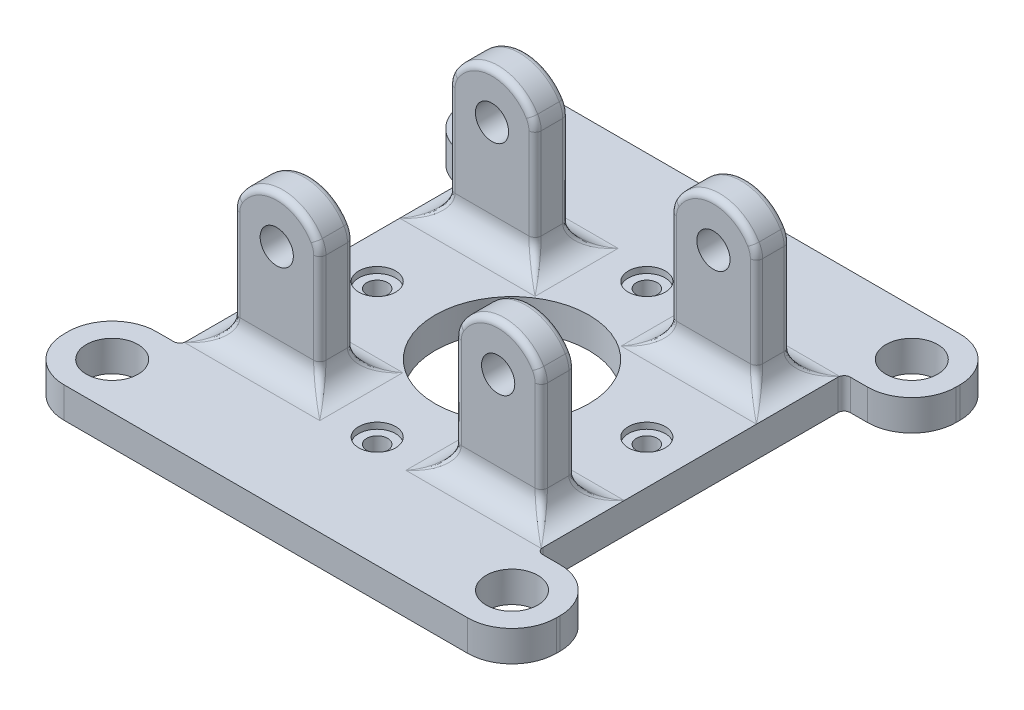
from build123d import *

# Parameters (mm, degrees)
SKETCH1_W                                        = 80
SKETCH1_H                                        = 80
SKETCH1_R                                        = 12.5
BOSS_EXTRUDE1_BASE_DEPTH                         = 5
SKETCH2_W                                        = 14
SKETCH2_H                                        = 5.5
BOSS_EXTRUDE2_FLAPS_DEPTH                        = 25
CUT_EXTRUDE1_SB_HOLE_AND_FLAP_GEO_REACH          = 80.295
SKETCH3_R                                        = 2.7
F_8_0MM_DOWEL_HOLE1_D                            = 8.4
CBORE_FOR_M3_HEX_HEAD_MACHINE_SCREW1_D           = 3.4
CBORE_FOR_M3_HEX_HEAD_MACHINE_SCREW1_CBORE_D     = 6
CBORE_FOR_M3_HEX_HEAD_MACHINE_SCREW1_CBORE_DEPTH = 1
CUT_EXTRUDE4_REACH                               = 63.646
SKETCH16_W                                       = 22
SKETCH16_H                                       = 50
FILLET1_R                                        = 4
FILLET2_R                                        = 1
FILLET3_R                                        = 7.2


with BuildPart() as part:
    # Sketch1 → Boss-Extrude1 - Base (new body)
    with BuildSketch(Plane(origin=(0, 0, 0), x_dir=(1, 0, 0), z_dir=(0, 1, 0))):
        Rectangle(SKETCH1_W, SKETCH1_H)
        with Locations(Location((0, 0, 0), (0, 0, 270))):
            Circle(SKETCH1_R, mode=Mode.SUBTRACT)
    extrude(amount=BOSS_EXTRUDE1_BASE_DEPTH)

    # Sketch2 → Boss-Extrude2 - Flaps (add)
    with BuildSketch(Plane(origin=(0, 5, 0), x_dir=(1, 0, 0), z_dir=(0, 1, 0))):
        with Locations((-18, -17.5)):
            Rectangle(SKETCH2_W, SKETCH2_H)
        with Locations((-18, 17.5)):
            Rectangle(SKETCH2_W, SKETCH2_H)
        with Locations((18, -17.5)):
            Rectangle(SKETCH2_W, SKETCH2_H)
        with Locations((18, 17.5)):
            Rectangle(SKETCH2_W, SKETCH2_H)
    extrude(amount=BOSS_EXTRUDE2_FLAPS_DEPTH)

    # Cut-Extrude1 - SB hole and flap geo.: up to this face of the body (flat: up to its plane)
    cut_extrude1_sb_hole_and_flap_geo_end = Plane(part.part.faces().sort_by_distance((-18, 17.5, -20.25))[0])
    # Sketch3 → Cut-Extrude1 - SB hole and flap geo. (cut, up to the picked face)
    with BuildSketch(Plane.XY.offset(20.25), mode=Mode.PRIVATE) as cut_extrude1_sb_hole_and_flap_geo_sk1:
        with Locations((-18, 22)):
            Circle(SKETCH3_R)
    cut_extrude1_sb_hole_and_flap_geo_tool1 = split(extrude(cut_extrude1_sb_hole_and_flap_geo_sk1.sketch, amount=-CUT_EXTRUDE1_SB_HOLE_AND_FLAP_GEO_REACH, mode=Mode.PRIVATE), bisect_by=cut_extrude1_sb_hole_and_flap_geo_end, keep=Keep.BOTH, mode=Mode.PRIVATE)
    # Sketch3 → Cut-Extrude1 - SB hole and flap geo. (cut, up to the picked face)
    with BuildSketch(Plane.XY.offset(20.25), mode=Mode.PRIVATE) as cut_extrude1_sb_hole_and_flap_geo_sk2:
        with BuildLine():
            Line((-25, 24.692582404), (-25, 30))
            Line((-25, 30), (-11, 30))
            Line((-11, 30), (-11, 24.692582404))
            ThreePointArc((-11, 24.692582404), (-18, 29.5), (-25, 24.692582404))
        make_face()
    cut_extrude1_sb_hole_and_flap_geo_tool2 = split(extrude(cut_extrude1_sb_hole_and_flap_geo_sk2.sketch, amount=-CUT_EXTRUDE1_SB_HOLE_AND_FLAP_GEO_REACH, mode=Mode.PRIVATE), bisect_by=cut_extrude1_sb_hole_and_flap_geo_end, keep=Keep.BOTH, mode=Mode.PRIVATE)
    cut_extrude1_sb_hole_and_flap_geo_1 = cut_extrude1_sb_hole_and_flap_geo_tool1.solids().sort_by(Axis((-18, 22, 20.25), (0, 0, -1)))[0]
    add(cut_extrude1_sb_hole_and_flap_geo_1, mode=Mode.SUBTRACT)
    cut_extrude1_sb_hole_and_flap_geo_2 = cut_extrude1_sb_hole_and_flap_geo_tool2.solids().sort_by(Axis((-18, 29.649723, 20.25), (0, 0, -1)))[0]
    add(cut_extrude1_sb_hole_and_flap_geo_2, mode=Mode.SUBTRACT)
    cut_extrude1_sb_hole_and_flap_geo = cut_extrude1_sb_hole_and_flap_geo_1 + cut_extrude1_sb_hole_and_flap_geo_2  # Cut-Extrude1 - SB hole and flap geo. as one shape, for the pattern or mirror that repeats it

    # Mirror1: Cut-Extrude1 - SB hole and flap geo. across plane
    add(cut_extrude1_sb_hole_and_flap_geo.mirror(Plane(origin=(0, 0, 0), x_dir=(0, 0, 1), z_dir=(1, 0, 0))), mode=Mode.SUBTRACT)

    # Ø8.0mm Dowel Hole1 (through all)
    with Locations(Plane(origin=(0, 5, 0), x_dir=(1, 0, 0), z_dir=(0, 1, 0))):
        with Locations((-32.5, 32.5), (32.5, 32.5), (32.5, -32.5), (-32.5, -32.5)):
            Hole(F_8_0MM_DOWEL_HOLE1_D / 2)

    # CBORE for M3 Hex Head Machine Screw1 (through all)
    with Locations(Plane(origin=(0, 5, 0), x_dir=(1, 0, 0), z_dir=(0, 1, 0))):
        with Locations((-21.920310217, 0), (0, 21.920310217), (21.920310217, 0), (0, -21.920310217)):
            CounterBoreHole(CBORE_FOR_M3_HEX_HEAD_MACHINE_SCREW1_D / 2, CBORE_FOR_M3_HEX_HEAD_MACHINE_SCREW1_CBORE_D / 2, CBORE_FOR_M3_HEX_HEAD_MACHINE_SCREW1_CBORE_DEPTH)

    # Sketch16 → Cut-Extrude4 (cut, up to next)
    with BuildSketch(Plane(origin=(0, 5, 0), x_dir=(1, 0, 0), z_dir=(0, 1, 0)), mode=Mode.PRIVATE) as cut_extrude4_sk1:
        with Locations((40, 0)):
            Rectangle(SKETCH16_W, SKETCH16_H)
    cut_extrude4_tool1 = extrude(cut_extrude4_sk1.sketch, amount=-CUT_EXTRUDE4_REACH, mode=Mode.PRIVATE) & part.part
    # Sketch16 → Cut-Extrude4 (cut, up to next)
    with BuildSketch(Plane(origin=(0, 5, 0), x_dir=(1, 0, 0), z_dir=(0, 1, 0)), mode=Mode.PRIVATE) as cut_extrude4_sk2:
        with Locations((-40, 0)):
            Rectangle(SKETCH16_W, SKETCH16_H)
    cut_extrude4_tool2 = extrude(cut_extrude4_sk2.sketch, amount=-CUT_EXTRUDE4_REACH, mode=Mode.PRIVATE) & part.part
    add(cut_extrude4_tool1.solids().sort_by_distance((40, 5, 0))[0], mode=Mode.SUBTRACT)
    add(cut_extrude4_tool2.solids().sort_by_distance((-40, 5, 0))[0], mode=Mode.SUBTRACT)

    # Fillet1
    fillet1_edges = [part.edges().sort_by_distance(p)[0] for p in [
        (25, 24.692582404, 17.5),
        (25, 24.692582404, -17.5),
        (11, 24.692582404, 17.5),
        (11, 24.692582404, -17.5),
        (-11, 5, -17.5),
        (-18, 5, -20.25),
        (-25, 5, -17.5),
        (-18, 5, -14.75),
        (-25, 5, 17.5),
        (-18, 5, 20.25),
        (-11, 5, 17.5),
        (-18, 5, 14.75),
        (18, 5, 14.75),
        (11, 5, 17.5),
        (18, 5, 20.25),
        (25, 5, 17.5),
        (25, 5, -17.5),
        (18, 5, -20.25),
        (11, 5, -17.5),
        (18, 5, -14.75),
        (-11, 24.692582404, -17.5),
        (-11, 24.692582404, 17.5),
        (-25, 24.692582404, -17.5),
        (-25, 24.692582404, 17.5),
    ]]
    fillet(fillet1_edges, radius=FILLET1_R - 0.0001)  # a hair under: the kernel refuses the full size

    # Fillet2
    fillet2_edges = [part.edges().sort_by_distance(p)[0] for p in [
        (-29, 2.5, -25),
        (-29, 2.5, 25),
        (29, 2.5, 25),
        (29, 2.5, -25),
        (25, 16.401351686, -14.75),
        (25, 16.401351686, -20.25),
        (18, 29.5, -14.75),
        (11, 16.401351686, -14.75),
        (11.14549568, 24.871806343, -14.75),
        (24.85450432, 24.871806343, -14.75),
        (18, 29.5, -20.25),
        (11, 16.401351686, -20.25),
        (11.14549568, 24.871806343, -20.25),
        (24.85450432, 24.871806343, -20.25),
        (-18, 29.5, -20.25),
        (-18, 29.5, -14.75),
        (-11, 16.401351686, -14.75),
        (-25, 16.401351686, -14.75),
        (-11.14549568, 24.871806343, -14.75),
        (-24.85450432, 24.871806343, -14.75),
        (-25, 16.401351686, -20.25),
        (-11, 16.401351686, -20.25),
        (-11.14549568, 24.871806343, -20.25),
        (-24.85450432, 24.871806343, -20.25),
        (25, 16.401351686, 20.25),
        (25, 16.401351686, 14.75),
        (18, 29.5, 20.25),
        (11, 16.401351686, 20.25),
        (11.14549568, 24.871806343, 20.25),
        (24.85450432, 24.871806343, 20.25),
        (18, 29.5, 14.75),
        (11, 16.401351686, 14.75),
        (11.14549568, 24.871806343, 14.75),
        (24.85450432, 24.871806343, 14.75),
        (-11, 16.401351686, 14.75),
        (-11, 16.401351686, 20.25),
        (-18, 29.5, 20.25),
        (-25, 16.401351686, 20.25),
        (-24.85450432, 24.871806343, 20.25),
        (-11.14549568, 24.871806343, 20.25),
        (-18, 29.5, 14.75),
        (-25, 16.401351686, 14.75),
        (-24.85450432, 24.871806343, 14.75),
        (-11.14549568, 24.871806343, 14.75),
        (-26.415768975, 5.946792263, -13.334231025),
        (-26.415768975, 5.946792263, -21.665768975),
        (-9.584231025, 5.946792263, -13.334231025),
        (-9.584231025, 5.946792263, -21.665768975),
        (26.415768975, 5.946792263, -13.334231025),
        (9.584231025, 5.946792263, -13.334231025),
        (26.415768975, 5.946792263, -21.665768975),
        (9.584231025, 5.946792263, -21.665768975),
        (9.584231025, 5.946792263, 21.665768975),
        (9.584231025, 5.946792263, 13.334231025),
        (26.415768975, 5.946792263, 21.665768975),
        (26.415768975, 5.946792263, 13.334231025),
        (-26.415768975, 5.946792263, 21.665768975),
        (-26.415768975, 5.946792263, 13.334231025),
        (-9.584231025, 5.946792263, 21.665768975),
        (-9.584231025, 5.946792263, 13.334231025),
    ]]
    fillet(fillet2_edges, radius=FILLET2_R)

    # Fillet3
    fillet3_edges = [part.edges().sort_by_distance(p)[0] for p in [
        (-40, 2.5, 25),
        (-40, 2.5, -25),
        (40, 2.5, 25),
        (40, 2.5, -25),
        (40, 2.5, 40),
        (-40, 2.5, 40),
        (-40, 2.5, -40),
        (40, 2.5, -40),
    ]]
    fillet(fillet3_edges, radius=FILLET3_R)


solid = part.part
